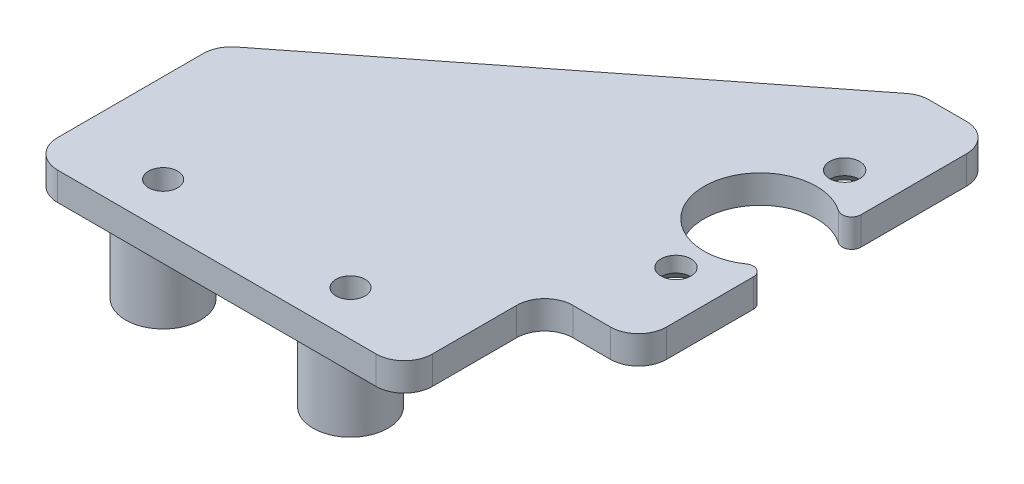
from build123d import *

# Parameters (mm, degrees)
ESBO_O1_R                  = 1.6
RESSALTO_EXTRUS_O10_DEPTH  = 3
FILETE2_R                  = 1
CHANFRO1_SIZE              = 1.35
ESBO_O5_W                  = 50
ESBO_O5_H                  = 13
RESSALTO_EXTRUS_O13_DEPTH  = 3
CORTE_EXTRUS_O1_DEPTH      = 42.509035161
CORTE_EXTRUS_O1_DEPTH_BACK = 42.509035161
ESBO_O7_R                  = 1.55
ESBO_O8_W                  = 10
ESBO_O8_H                  = 15
CORTE_EXTRUS_O2_DEPTH      = 42.509035161
FILETE3_R                  = 3
ESBO_O9_R                  = 4
RESSALTO_EXTRUS_O14_DEPTH  = 8
ESBO_O10_R                 = 1.55
CORTE_EXTRUS_O5_DEPTH      = 43.166337285


with BuildPart() as part:
    # Esboço1 → Ressalto-extrusão10 (new body)
    with BuildSketch(Plane(origin=(0, 0, 0), x_dir=(1, 0, 0), z_dir=(0, 1, 0))):
        with BuildLine():
            Line((25, 20), (-25, 20))
            Line((-25, 20), (-25, -20))
            Line((-25, -20), (25, -20))
            Line((25, -20), (25, -3.31662479))
            ThreePointArc((25, -3.31662479), (14, 0), (25, 3.31662479))
            Line((25, 3.31662479), (25, 20))
        make_face()
        with Locations((20, -9)):
            Circle(ESBO_O1_R, mode=Mode.SUBTRACT)
        with Locations((20, 9)):
            Circle(ESBO_O1_R, mode=Mode.SUBTRACT)
    extrude(amount=RESSALTO_EXTRUS_O10_DEPTH)

    # Filete2
    filete2_edges = [part.edges().sort_by_distance(p)[0] for p in [
        (25, 1.5, -3.31662479),
        (25, 1.5, 3.31662479),
    ]]
    fillet(filete2_edges, radius=FILETE2_R)

    # Chanfro1
    chanfro1_edges = [part.edges().sort_by_distance(p)[0] for p in [
        (18.4, 0, -9),
        (18.4, 0, 9),
    ]]
    chamfer(chanfro1_edges, length=CHANFRO1_SIZE)

    # Esboço5 → Ressalto-extrusão13 (add)
    with BuildSketch(Plane.XZ):
        with Locations((0, 26.5)):
            Rectangle(ESBO_O5_W, ESBO_O5_H)
    extrude(amount=-RESSALTO_EXTRUS_O13_DEPTH)

    # Esboço7 → Corte-extrusão1 (cut, two sides: drawn at the far end of the back side and taken through both)
    with BuildSketch(Plane.XZ.offset(-CORTE_EXTRUS_O1_DEPTH_BACK)):
        with Locations((-15.5, 28.234562647)):
            Circle(ESBO_O7_R)
        with Locations((4.5, 28.234562647)):
            Circle(ESBO_O7_R)
    extrude(amount=CORTE_EXTRUS_O1_DEPTH + CORTE_EXTRUS_O1_DEPTH_BACK, mode=Mode.SUBTRACT)

    # Esboço8 → Corte-extrusão2 (cut, through all)
    with BuildSketch(Plane.XZ):
        Polygon((-25, -20), (-25, 13), (17, -20), align=None)
        with Locations((20, 25.5)):
            Rectangle(ESBO_O8_W, ESBO_O8_H)
    extrude(amount=-CORTE_EXTRUS_O2_DEPTH, mode=Mode.SUBTRACT)

    # Filete3
    filete3_edges = [part.edges().sort_by_distance(p)[0] for p in [
        (15, 1.5, 18),
        (-25, 1.5, 13),
        (-25, 1.5, 33),
        (15, 1.5, 33),
        (25, 1.5, 18),
        (25, 1.5, -20),
        (17, 1.5, -20),
    ]]
    fillet(filete3_edges, radius=FILETE3_R)

    # Esboço9 → Ressalto-extrusão14 (add)
    with BuildSketch(Plane.XZ):
        with Locations((-15.5, 28.234562647)):
            Circle(ESBO_O9_R)
        with Locations((4.5, 28.234562647)):
            Circle(ESBO_O9_R)
        with Locations((-5.5, 10.234562647)):
            Circle(ESBO_O9_R)
    extrude(amount=RESSALTO_EXTRUS_O14_DEPTH)

    # Esboço10 → Corte-extrusão5 (cut, through all)
    with BuildSketch(Plane.XZ):
        with Locations((-15.5, 28.234562647)):
            Circle(ESBO_O10_R)
        with Locations((4.5, 28.234562647)):
            Circle(ESBO_O10_R)
    extrude(amount=CORTE_EXTRUS_O5_DEPTH, mode=Mode.SUBTRACT)


solid = part.part
